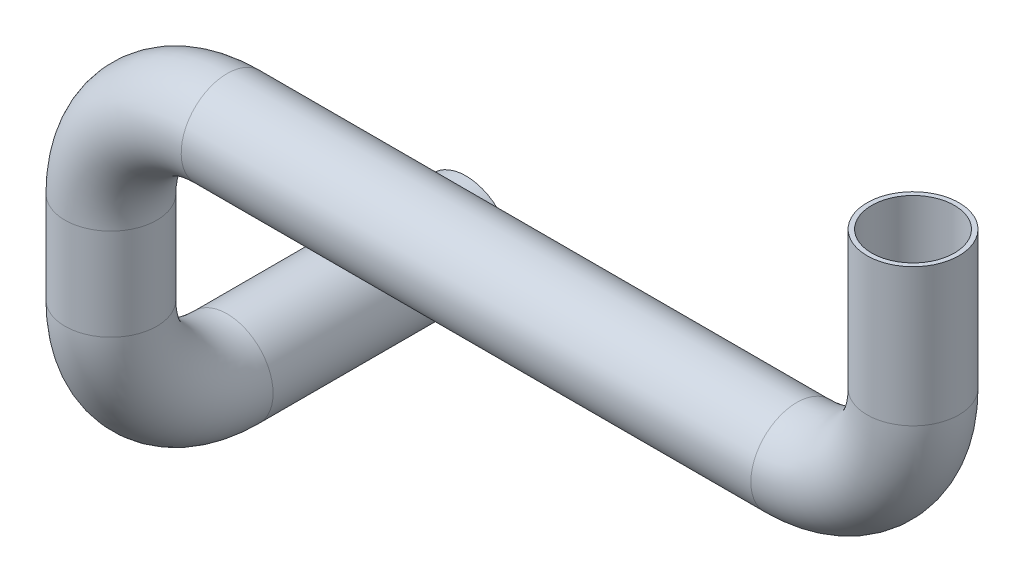
from build123d import *

# Parameters (mm, degrees)
SKETCH2_R          = 5
SWEEP2_OUTLINE_R   = 5
SWEEP2_ANGLE       = 90
SWEEP2_START       = -38.65
SWEEP2_2_OUTLINE_R = 5
SWEEP2_2_DEPTH     = 26.65
SHELL1_T           = -0.5


with BuildPart() as part:
    # Sweep1: sweep along a path in Sketch3
    with BuildLine(Plane.XY) as sweep1_path:
        Line((0, 0), (0, 10))
        ThreePointArc((0, 10), (3.705099218, 18.944900782), (12.65, 22.65))
        Line((12.65, 22.65), (74.65, 22.65))
        ThreePointArc((74.65, 22.65), (83.594900782, 26.355099218), (87.3, 35.3))
        Line((87.3, 35.3), (87.3, 50.3))
    # Sketch2 → Sweep1 (sweep)
    with BuildSketch(Plane(origin=(0, 0, 0), x_dir=(1, 0, 0), z_dir=(0, 1, 0))):
        Circle(SKETCH2_R)
    sweep(path=sweep1_path.line)

    # Sweep2: read off the stored shape, not the designer's step
    # Sweep2 outline → Sweep2 (revolve)
    with BuildSketch(Plane(origin=(0, 0, -12.65), x_dir=(0, 0, 1), z_dir=(0, 1, 0))):
        with Locations((12.65, 0)):
            Circle(SWEEP2_OUTLINE_R)
    revolve(axis=Axis((0, 0, -12.65), (1, 0, 0)), revolution_arc=SWEEP2_ANGLE)

    # Sweep2 2 outline → Sweep2 2 (add)
    with BuildSketch(Plane.XY.offset(SWEEP2_START)):
        with Locations((0, -12.65)):
            Circle(SWEEP2_2_OUTLINE_R)
    extrude(amount=SWEEP2_2_DEPTH)

    # Shell1
    shell1_openings = [part.faces().sort_by_distance(p)[0] for p in [
        (0, -12.65, -38.65),
        (87.3, 50.3, 0),
    ]]
    offset(amount=SHELL1_T, openings=shell1_openings, kind=Kind.INTERSECTION)


solid = part.part
